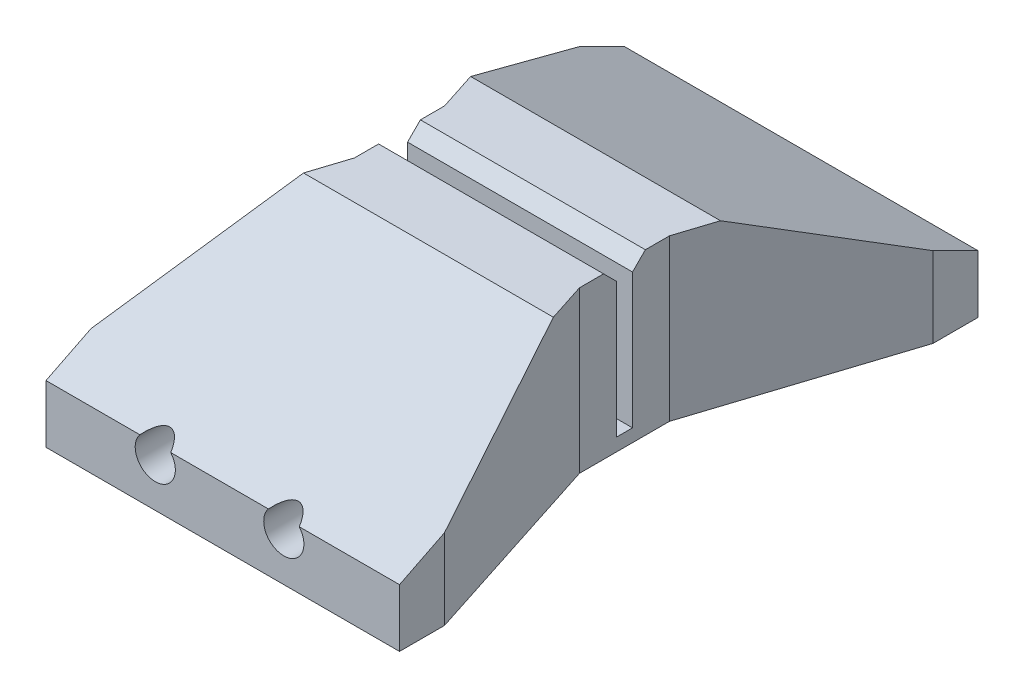
from build123d import *

# Parameters (mm, degrees)
SKETCH2_W               = 69.85
SKETCH2_H               = 114.3
BOSS_EXTRUDE1_DEPTH     = 31.75
CUT_EXTRUDE1_DEPTH      = 96.672396751
CUT_EXTRUDE1_DEPTH_BACK = 96.672396751
SKETCH4_W               = 69.85
SKETCH4_H               = 3.175
CUT_EXTRUDE2_DEPTH      = 29.21
CHAMFER1_SIZE           = 2.54
CUT_EXTRUDE3_DEPTH      = 75.121121315
CUT_EXTRUDE3_DEPTH_BACK = 75.121121315
SKETCH5_3_R             = 2.032
CUT_EXTRUDE4_DEPTH      = 9.525
CUT_EXTRUDE6_DEPTH      = 76.351921218
CUT_EXTRUDE6_DEPTH_BACK = 12.7
SKETCH6_R               = 2.032
CUT_EXTRUDE7_REACH      = 79.852
SKETCH7_R               = 3.96875


with BuildPart() as part:
    # Sketch2 → Boss-Extrude1 (new body)
    with BuildSketch(Plane(origin=(0, 0, 0), x_dir=(1, 0, 0), z_dir=(0, 1, 0))):
        Rectangle(SKETCH2_W, SKETCH2_H)
    extrude(amount=BOSS_EXTRUDE1_DEPTH)

    # Sketch3 → Cut-Extrude1 (cut, two sides: drawn at the far end of the back side and taken through both)
    with BuildSketch(Plane.ZY.offset(34.925).offset(-CUT_EXTRUDE1_DEPTH_BACK)):
        Polygon((-57.15, 31.75), (-57.15, 11.43), (-16.51, 31.75), align=None)
        Polygon((57.15, 31.75), (16.51, 31.75), (57.15, 11.43), align=None)
    extrude(amount=CUT_EXTRUDE1_DEPTH + CUT_EXTRUDE1_DEPTH_BACK, mode=Mode.SUBTRACT)

    # Sketch4 → Cut-Extrude2 (cut)
    with BuildSketch(Plane(origin=(0, 31.75, 0), x_dir=(1, 0, 0), z_dir=(0, 1, 0))):
        Rectangle(SKETCH4_W, SKETCH4_H)
    extrude(amount=-CUT_EXTRUDE2_DEPTH, mode=Mode.SUBTRACT)

    # Chamfer1
    chamfer1_edges = [part.edges().sort_by_distance(p)[0] for p in [
        (0, 31.75, -1.5875),
        (0, 31.75, 1.5875),
    ]]
    chamfer(chamfer1_edges, length=CHAMFER1_SIZE)

    # Sketch5 → Cut-Extrude3 (cut, two sides: drawn at the far end of the back side and taken through both)
    with BuildSketch(Plane.XZ.offset(-CUT_EXTRUDE3_DEPTH_BACK)):
        Polygon((-22.225, 8.89), (-34.925, 48.26), (-34.925, -48.26), (-22.225, -8.89), align=None)
        Polygon((34.925, -48.26), (34.925, 48.26), (22.225, 8.89), (22.225, -8.89), align=None)
    extrude(amount=CUT_EXTRUDE3_DEPTH + CUT_EXTRUDE3_DEPTH_BACK, mode=Mode.SUBTRACT)

    # Sketch5<3> → Cut-Extrude4 (cut)
    with BuildSketch(Plane.XZ):
        with Locations((-21.59, 25.4)):
            Circle(SKETCH5_3_R)
        with Locations((21.59, 25.4)):
            Circle(SKETCH5_3_R)
        with Locations((21.59, -25.4)):
            Circle(SKETCH5_3_R)
        with Locations((-21.59, -25.4)):
            Circle(SKETCH5_3_R)
        with Locations((-8.89, 25.4)):
            Circle(SKETCH5_3_R)
        with Locations((8.89, 25.4)):
            Circle(SKETCH5_3_R)
        with Locations((-8.89, -25.4)):
            Circle(SKETCH5_3_R)
        with Locations((8.89, -25.4)):
            Circle(SKETCH5_3_R)
    extrude(amount=-CUT_EXTRUDE4_DEPTH, mode=Mode.SUBTRACT)

    # Sketch6 → Cut-Extrude6 (cut, two sides: drawn at the far end of the back side and taken through both)
    with BuildSketch(Plane.XY.offset(-1.5875).offset(-CUT_EXTRUDE6_DEPTH_BACK)):
        with Locations((-13.335, 8.89)):
            Circle(SKETCH6_R)
        with Locations((12.065, 8.89)):
            Circle(SKETCH6_R)
    extrude(amount=CUT_EXTRUDE6_DEPTH + CUT_EXTRUDE6_DEPTH_BACK, mode=Mode.SUBTRACT)

    # Sketch7 → Cut-Extrude7 (cut, up to next)
    with BuildSketch(Plane(origin=(0, 0, 4.7625), x_dir=(-1, 0, 0), z_dir=(0, 0, -1)), mode=Mode.PRIVATE) as cut_extrude7_sk1:
        with Locations((13.335, 8.89)):
            Circle(SKETCH7_R)
    cut_extrude7_tool1 = extrude(cut_extrude7_sk1.sketch, amount=-CUT_EXTRUDE7_REACH, mode=Mode.PRIVATE) & part.part
    # Sketch7 → Cut-Extrude7 (cut, up to next)
    with BuildSketch(Plane(origin=(0, 0, 4.7625), x_dir=(-1, 0, 0), z_dir=(0, 0, -1)), mode=Mode.PRIVATE) as cut_extrude7_sk2:
        with Locations((-12.065, 8.89)):
            Circle(SKETCH7_R)
    cut_extrude7_tool2 = extrude(cut_extrude7_sk2.sketch, amount=-CUT_EXTRUDE7_REACH, mode=Mode.PRIVATE) & part.part
    add(cut_extrude7_tool1.solids().sort_by_distance((-13.335, 8.89, 4.7625))[0], mode=Mode.SUBTRACT)
    add(cut_extrude7_tool2.solids().sort_by_distance((12.065, 8.89, 4.7625))[0], mode=Mode.SUBTRACT)


solid = part.part
